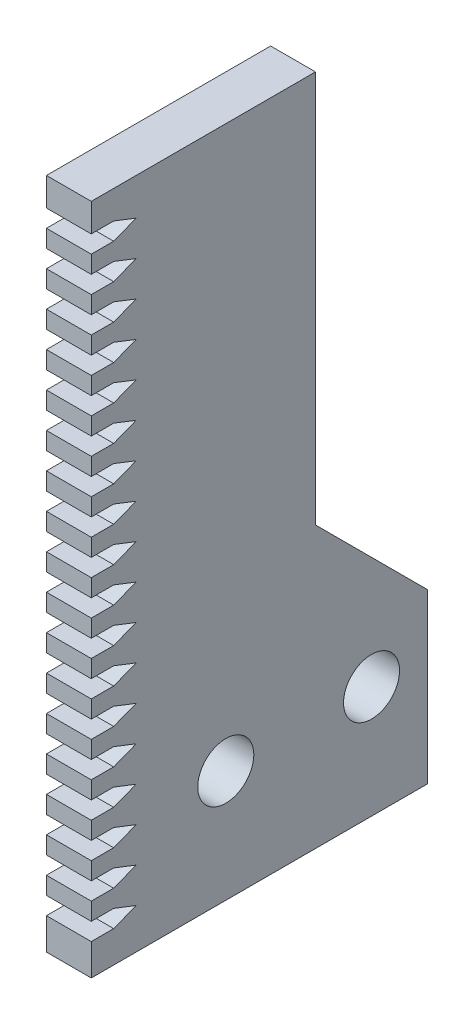
from build123d import *

# Parameters (mm, degrees)
SKETCH_1_R             = 2.5
EXTRUDE_1_DEPTH        = 4
CUT_EXTRUDE_1_DEPTH    = 4
PATTERN_LINEAR_1_COUNT = 18
PATTERN_LINEAR_1_PITCH = 3.123741803


with BuildPart() as part:
    # Эскиз1 → Бобышка-Вытянуть1 (new body)
    with BuildSketch(Plane(origin=(0, 0, 0), x_dir=(0, 0, -1), z_dir=(1, 0, 0))):
        Polygon((30, 15), (20, 25), (20, 60), (0, 60), (0, 0), (30, 0), align=None)
        with Locations((12, 10)):
            Circle(SKETCH_1_R, mode=Mode.SUBTRACT)
        with Locations((25, 10)):
            Circle(SKETCH_1_R, mode=Mode.SUBTRACT)
    extrude(amount=EXTRUDE_1_DEPTH)

    # Эскиз2 → Вырез-Вытянуть1 (cut)
    with BuildSketch(Plane(origin=(4, 0, 0), x_dir=(0, 0, -1), z_dir=(1, 0, 0))):
        Polygon((4, 3.59632646), (2, 4.37726191), (0, 4.37726191), (0, 2.81539101), (2, 2.81539101), align=None)
    cut_extrude_1 = extrude(amount=-CUT_EXTRUDE_1_DEPTH, mode=Mode.SUBTRACT)

    # Линейный массив1: Вырез-Вытянуть1 ×18
    with Locations(*[(0, i * PATTERN_LINEAR_1_PITCH, 0) for i in range(1, PATTERN_LINEAR_1_COUNT)]):
        add(cut_extrude_1, mode=Mode.SUBTRACT)


solid = part.part
